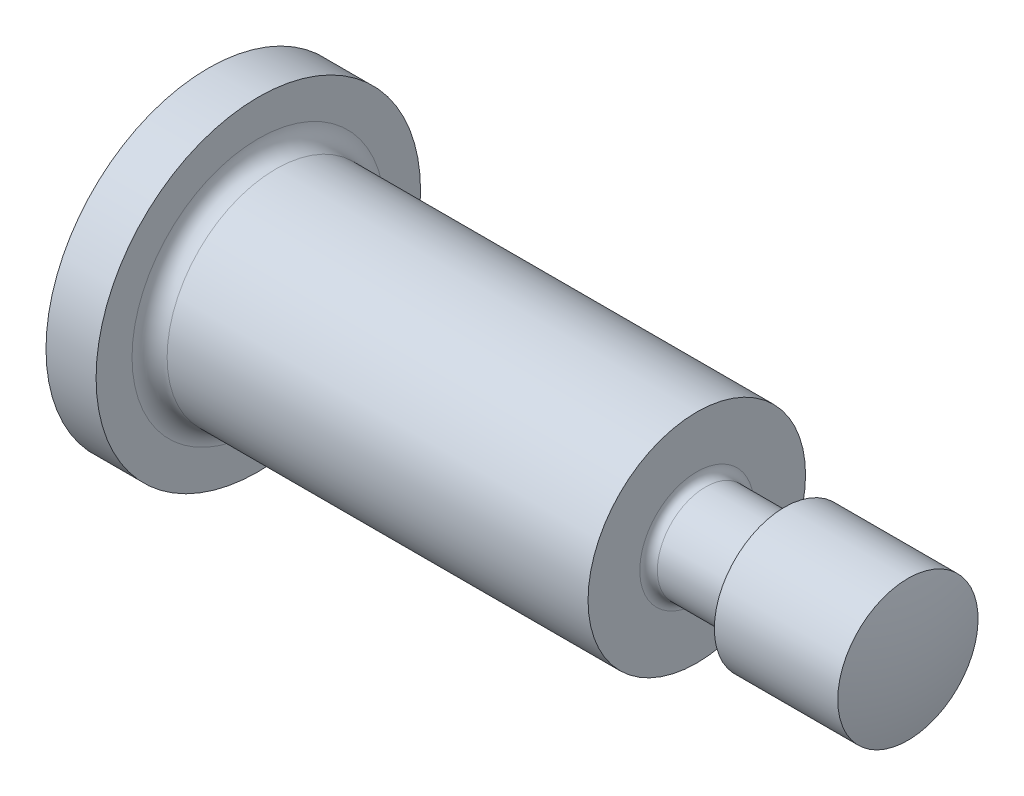
from build123d import *

# Parameters (mm, degrees)
SKETCH1_R       = 1.85
BASEHEAD_DEPTH  = 1.1
SKETCH2_R       = 1.24
BASEBODY_DEPTH  = 5
SKETCH3_R       = 0.8
BASEEND_DEPTH   = 2.5
SKETCH4_W       = 5
SKETCH4_H       = 1
FILLET1_R       = 0.1
SLOT_DEPTH      = 11.000749972
SLOT_DEPTH_BACK = 11.000749972
SKETCH5_W       = 0.5
SKETCH5_H       = 0.5
HEADFILLET_R    = 0.2


with BuildPart() as part:
    # Sketch1 → BaseHead (new body)
    with BuildSketch(Plane(origin=(0, 0, 0), x_dir=(0, 0, -1), z_dir=(1, 0, 0))):
        Circle(SKETCH1_R)
    extrude(amount=BASEHEAD_DEPTH)

    # Sketch2 → BaseBody (add)
    with BuildSketch(Plane(origin=(1.1, -0.609134151, 0.454793612), x_dir=(0, 0, -1), z_dir=(1, 0, 0))):
        with Locations((0.454793612, 0.609134151)):
            Circle(SKETCH2_R)
    extrude(amount=BASEBODY_DEPTH)

    # Sketch3 → BaseEnd (add)
    with BuildSketch(Plane(origin=(6.1, 0.539141531, 0.193652772), x_dir=(0, 0, -1), z_dir=(1, 0, 0))):
        with Locations((0.193652772, -0.539141531)):
            Circle(SKETCH3_R)
    extrude(amount=BASEEND_DEPTH)

    # Sketch4 → Cut-Revolve2 (revolve, cut)
    with BuildSketch(Plane(origin=(-6.100035879, 0.550035879, 0), x_dir=(0, -1, 0), z_dir=(0, 0, 1))):
        with Locations((-2.499964121, 12.70003588)):
            Rectangle(SKETCH4_W, SKETCH4_H)
    revolve(axis=Axis((2.427994809, 0, 0), (-1, 0, 0)), mode=Mode.SUBTRACT)

    # Fillet1
    fillet1_edges = [part.edges().sort_by_distance(p)[0] for p in [
        (7.1, -0.55, 0),
        (6.1, -0.55, 0),
    ]]
    fillet(fillet1_edges, radius=FILLET1_R)

    # Sketch5 → Slot (cut, two sides: drawn at the far end of the back side and taken through both)
    with BuildSketch(Plane(origin=(-0.85, -0.85, 0), x_dir=(0, 1, 0), z_dir=(0, 0, 1)).offset(-SLOT_DEPTH_BACK)):
        with Locations((0.85, -1.1)):
            Rectangle(SKETCH5_W, SKETCH5_H)
    extrude(amount=SLOT_DEPTH + SLOT_DEPTH_BACK, mode=Mode.SUBTRACT)

    # Sketch6 → BaseTop (revolve, cut)
    with BuildSketch(Plane(origin=(-7.588764327, 2.088764327, 0), x_dir=(0, -1, 0), z_dir=(0, 0, 1))):
        with BuildLine():
            Line((-1.411235673, 12.688764327), (-3.411235673, 12.688764327))
            Line((-3.411235673, 12.688764327), (-3.411235673, 18.188764327))
            Line((-3.411235673, 18.188764327), (2.088764327, 18.188764327))
            Line((2.088764327, 18.188764327), (2.088764327, 16.188764327))
            ThreePointArc((2.088764327, 16.188764327), (-0.386109407, 15.163638061), (-1.411235673, 12.688764327))
        make_face()
        with BuildLine():
            Line((0.238764327, 5.588764327), (2.088764327, 5.588764327))
            Line((2.088764327, 5.588764327), (2.088764327, 7.588764327))
            ThreePointArc((2.088764327, 7.588764327), (1.126706159, 7.723583191), (0.238764327, 8.117653424))
            Line((0.238764327, 8.117653424), (0.238764327, 5.588764327))
        make_face()
    revolve(axis=Axis((5.660097479, 0, 0), (-1, 0, 0)), mode=Mode.SUBTRACT)

    # HeadFillet
    headfillet_edges = [part.edges().sort_by_distance(p)[0] for p in [
        (1.1, 0, 1.24),
    ]]
    fillet(headfillet_edges, radius=HEADFILLET_R)


solid = part.part
